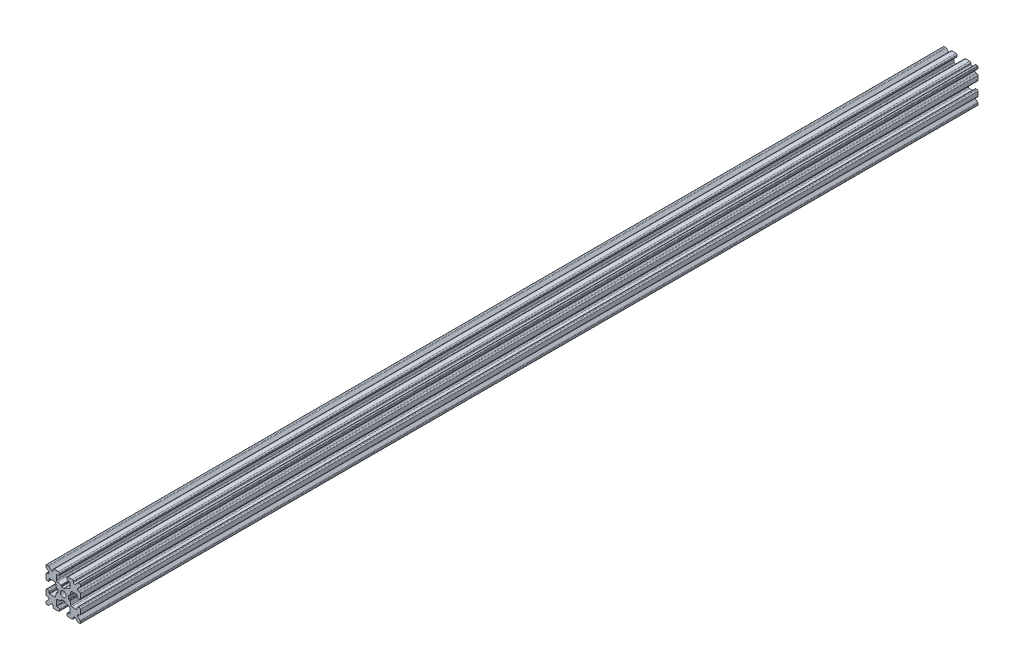
from build123d import *

# Parameters (mm, degrees)
SKETCH1_W           = 15
SKETCH1_H           = 15
SKETCH1_R           = 1.25
BOSS_EXTRUDE1_DEPTH = 196
FILLET1_R           = 0.25
CUT_EXTRUDE1_DEPTH  = 393.143468644
CUT_EXTRUDE3_DEPTH  = 393.143468644
FILLET3_R           = 0.5
FILLET4_R           = 0.5
FILLET5_R           = 3
FILLET6_R           = 0.2
CUT_EXTRUDE4_DEPTH  = 393.143468644
FILLET8_R           = 0.5
SKETCH6_W           = 5.1529354
SKETCH6_H           = 1.651
SKETCH6_W_2         = 1.651
SKETCH6_H_2         = 5.1529354
CUT_EXTRUDE5_DEPTH  = 393.143468644
FILLET10_R          = 0.2


with BuildPart() as part:
    # Sketch1 → Boss-Extrude1 (new, symmetric)
    with BuildSketch(Plane.XY):
        Rectangle(SKETCH1_W, SKETCH1_H)
        Circle(SKETCH1_R, mode=Mode.SUBTRACT)
    extrude(amount=BOSS_EXTRUDE1_DEPTH, both=True)

    # Fillet1
    fillet1_edges = [part.edges().sort_by_distance(p)[0] for p in [
        (7.5, -7.5, 0),
        (-7.5, -7.5, 0),
        (7.5, 7.5, 0),
        (-7.5, 7.5, 0),
    ]]
    fillet(fillet1_edges, radius=FILLET1_R)

    # Sketch2 → Cut-Extrude1 (cut, through all)
    with BuildSketch(Plane.XY.offset(196)):
        Polygon((-7.5, 1.6), (-6.1, 1.6), (-6.1, 2.9), (-3.4, 2.9), (-3.4, -2.9), (-6.1, -2.9), (-6.1, -1.6), (-7.5, -1.6), align=None)
        Polygon((2.9, 6.1), (1.6, 6.1), (1.6, 7.5), (-1.6, 7.5), (-1.6, 6.1), (-2.9, 6.1), (-2.9, 3.4), (2.9, 3.4), align=None)
        Polygon((-1.6, -7.5), (-1.6, -6.1), (-2.9, -6.1), (-2.9, -3.4), (2.9, -3.4), (2.9, -6.1), (1.6, -6.1), (1.6, -7.5), align=None)
        Polygon((6.1, -2.9), (6.1, -1.6), (7.5, -1.6), (7.5, 1.6), (6.1, 1.6), (6.1, 2.9), (3.4, 2.9), (3.4, -2.9), align=None)
    extrude(amount=-CUT_EXTRUDE1_DEPTH, mode=Mode.SUBTRACT)

    # Sketch4 → Cut-Extrude3 (cut, through all)
    with BuildSketch(Plane.XY.offset(196)):
        Polygon((-3.4, 2.9), (-2.75, 0), (-3.4, -2.9), align=None)
        Polygon((-2.9, 3.4), (0, 2.75), (2.9, 3.4), align=None)
        Polygon((3.4, 2.9), (2.75, 0), (3.4, -2.9), align=None)
        Polygon((-2.9, -3.4), (0, -2.75), (2.9, -3.4), align=None)
    extrude(amount=-CUT_EXTRUDE3_DEPTH, mode=Mode.SUBTRACT)

    # Fillet3
    fillet3_edges = [part.edges().sort_by_distance(p)[0] for p in [
        (-6.1, -1.6, 0),
        (-7.5, -1.6, 0),
        (-6.1, 1.6, 0),
        (-7.5, 1.6, 0),
        (-1.6, -7.5, 0),
        (-1.6, -6.1, 0),
        (1.6, -7.5, 0),
        (1.6, -6.1, 0),
        (6.1, -1.6, 0),
        (7.5, -1.6, 0),
        (7.5, 1.6, 0),
        (6.1, 1.6, 0),
        (1.6, 7.5, 0),
        (1.6, 6.1, 0),
        (-1.6, 7.5, 0),
        (-1.6, 6.1, 0),
    ]]
    fillet(fillet3_edges, radius=FILLET3_R)

    # Fillet4
    fillet4_edges = [part.edges().sort_by_distance(p)[0] for p in [
        (-3.4, 2.9, 0),
        (-3.4, -2.9, 0),
        (2.9, -3.4, 0),
        (-2.9, -3.4, 0),
        (3.4, -2.9, 0),
        (3.4, 2.9, 0),
        (-2.9, 3.4, 0),
        (2.9, 3.4, 0),
    ]]
    fillet(fillet4_edges, radius=FILLET4_R)

    # Fillet5
    fillet5_edges = [part.edges().sort_by_distance(p)[0] for p in [
        (0, -2.75, 0),
        (2.75, 0, 0),
        (-2.75, 0, 0),
        (0, 2.75, 0),
    ]]
    fillet(fillet5_edges, radius=FILLET5_R)

    # Fillet6
    fillet6_edges = [part.edges().sort_by_distance(p)[0] for p in [
        (-2.9, -6.1, 0),
        (2.9, -6.1, 0),
        (6.1, -2.9, 0),
        (6.1, 2.9, 0),
        (2.9, 6.1, 0),
        (-2.9, 6.1, 0),
        (-6.1, -2.9, 0),
        (-6.1, 2.9, 0),
    ]]
    fillet(fillet6_edges, radius=FILLET6_R)

    # Sketch5 → Cut-Extrude4 (cut, through all)
    with BuildSketch(Plane.XY.offset(196)):
        Polygon((-7.5, 6.439339828), (-5.460660172, 4.4), (-7.5, 4.4), align=None)
        Polygon((-6.439339828, 7.5), (-4.4, 5.460660172), (-4.4, 7.5), align=None)
        Polygon((4.4, 7.5), (6.439339828, 7.5), (4.4, 5.460660172), align=None)
        Polygon((7.5, 6.439339828), (7.5, 4.4), (5.460660172, 4.4), align=None)
        Polygon((7.5, -6.439339828), (5.460660172, -4.4), (7.5, -4.4), align=None)
        Polygon((6.439339828, -7.5), (4.4, -5.460660172), (4.4, -7.5), align=None)
        Polygon((-4.4, -7.5), (-6.439339828, -7.5), (-4.4, -5.460660172), align=None)
        Polygon((-7.5, -6.439339828), (-7.5, -4.4), (-5.460660172, -4.4), align=None)
    extrude(amount=-CUT_EXTRUDE4_DEPTH, mode=Mode.SUBTRACT)

    # Fillet8
    fillet8_edges = [part.edges().sort_by_distance(p)[0] for p in [
        (-5.460660172, 4.4, 0),
        (-7.5, 4.4, 0),
        (-5.460660172, -4.4, 0),
        (-7.5, -4.4, 0),
        (-4.4, -7.5, 0),
        (-4.4, -5.460660172, 0),
        (4.4, -7.5, 0),
        (4.4, -5.460660172, 0),
        (5.460660172, -4.4, 0),
        (7.5, -4.4, 0),
        (7.5, 4.4, 0),
        (5.460660172, 4.4, 0),
        (4.4, 5.460660172, 0),
        (4.4, 7.5, 0),
        (-4.4, 5.460660172, 0),
        (-4.4, 7.5, 0),
        (-6.439339828, 7.5, 0),
        (-7.5, 6.439339828, 0),
        (6.439339828, 7.5, 0),
        (7.5, 6.439339828, 0),
        (6.439339828, -7.5, 0),
        (7.5, -6.439339828, 0),
        (-6.439339828, -7.5, 0),
        (-7.5, -6.439339828, 0),
    ]]
    fillet(fillet8_edges, radius=FILLET8_R)

    # Sketch6 → Cut-Extrude5 (cut, through all)
    with BuildSketch(Plane.XY.offset(196)):
        with Locations((4.9235323, 0)):
            Rectangle(SKETCH6_W, SKETCH6_H)
        with Locations((0, -4.9235323)):
            Rectangle(SKETCH6_W_2, SKETCH6_H_2)
        with Locations((-4.9235323, 0)):
            Rectangle(SKETCH6_W, SKETCH6_H)
        with Locations((0, 4.9235323)):
            Rectangle(SKETCH6_W_2, SKETCH6_H_2)
    extrude(amount=-CUT_EXTRUDE5_DEPTH, mode=Mode.SUBTRACT)

    # Fillet10
    fillet10_edges = [part.edges().sort_by_distance(p)[0] for p in [
        (-2.935025862, 0.8255, 0),
        (-2.935025862, -0.8255, 0),
        (2.935025862, -0.8255, 0),
        (2.935025862, 0.8255, 0),
        (0.8255, 2.935025862, 0),
        (-0.8255, 2.935025862, 0),
        (-2.3470646, 0.8255, 0),
        (-2.3470646, -0.8255, 0),
        (0.8255, 2.3470646, 0),
        (-0.8255, 2.3470646, 0),
        (2.3470646, 0.8255, 0),
        (2.3470646, -0.8255, 0),
        (0.8255, -2.935025862, 0),
        (0.8255, -2.3470646, 0),
        (-0.8255, -2.3470646, 0),
        (-0.8255, -2.935025862, 0),
    ]]
    fillet(fillet10_edges, radius=FILLET10_R)


solid = part.part
